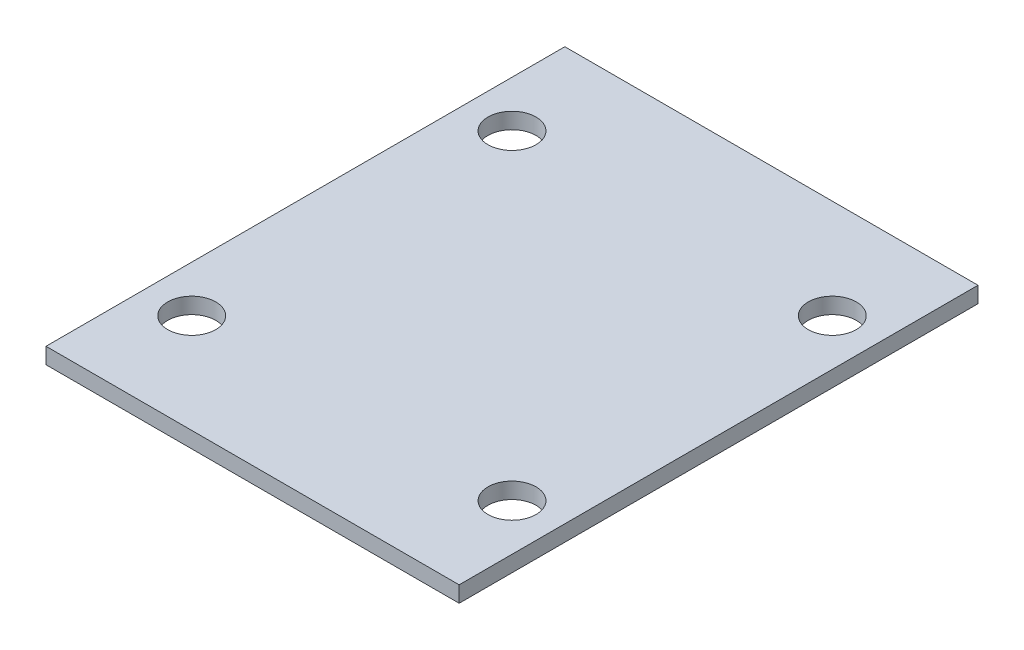
from build123d import *

# Parameters (mm, degrees)
SKETCH1_W           = 25.8
SKETCH1_H           = 32.4
SKETCH1_R           = 1.5
BOSS_EXTRUDE1_DEPTH = 1


# Read off the part's stored shape, not the designer's step: Surface-Imported1
with BuildPart() as part:
    # Sketch1 → Boss-Extrude1 (new body)
    with BuildSketch(Plane(origin=(0, 16.702220373, 0), x_dir=(1, 0, 0), z_dir=(0, 1, 0))):
        with Locations((3.227155678, -9.943684326)):
            Rectangle(SKETCH1_W, SKETCH1_H)
        with Locations(Location((13.227155678, -19.943684326, 0), (0, 0, 180))):
            Circle(SKETCH1_R, mode=Mode.SUBTRACT)
        with Locations(Location((13.227155678, 0.056315674, 0), (0, 0, 180))):
            Circle(SKETCH1_R, mode=Mode.SUBTRACT)
        with Locations(Location((-6.772844322, 0.056315674, 0), (0, 0, 180))):
            Circle(SKETCH1_R, mode=Mode.SUBTRACT)
        with Locations(Location((-6.772844322, -19.943684326, 0), (0, 0, 180))):
            Circle(SKETCH1_R, mode=Mode.SUBTRACT)
    extrude(amount=BOSS_EXTRUDE1_DEPTH)


solid = part.part
